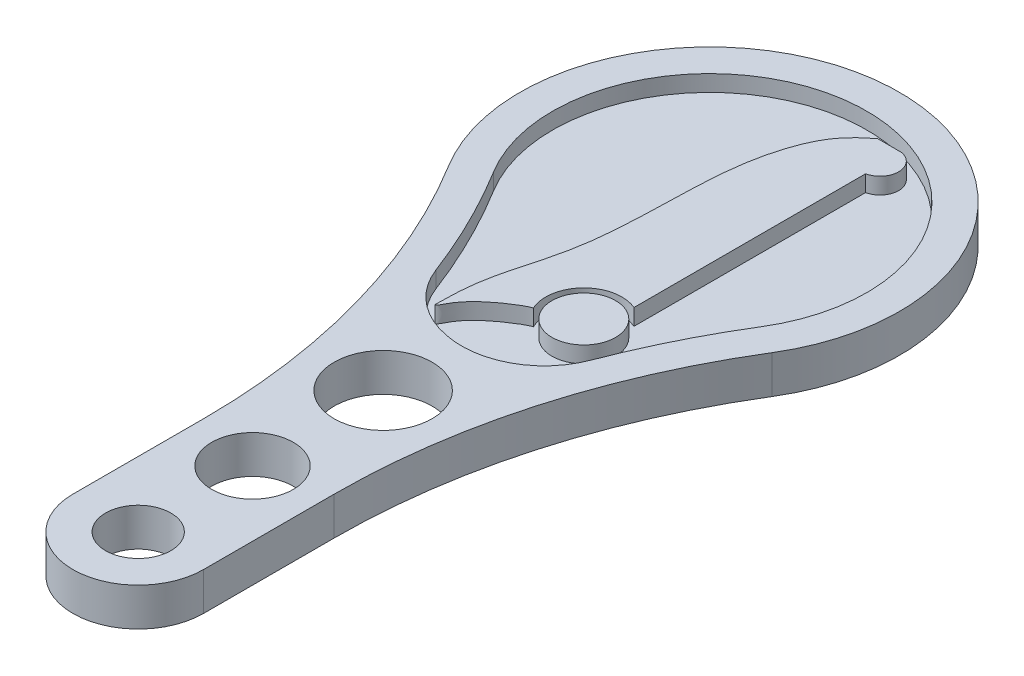
from build123d import *

# Parameters (mm, degrees)
SKETCH1_R               = 2
BOSS_EXTRUDE1_DEPTH     = 2.33
FILLET1_R               = 40
SKETCH3_R               = 2.5
SKETCH3_R_2             = 3
CUT_EXTRUDE1_DEPTH      = 41.762354262
CUT_EXTRUDE3_DEPTH      = 1
BOSS_EXTRUDE3_START     = -1
BOSS_EXTRUDE3_OUTLINE_R = 1.949204175
BOSS_EXTRUDE3_DEPTH     = 1
FILLET2_R               = 5


# Read off the part's stored shape, not the designer's step: Boss-Extrude3
with BuildPart() as part:
    # Sketch1 → Boss-Extrude1 (new body)
    with BuildSketch(Plane(origin=(0, 0, 0), x_dir=(1, 0, 0), z_dir=(0, 1, 0))):
        with BuildLine():
            Line((-3.993715603, -10.917456695), (-4, -35))
            ThreePointArc((-4, -35), (0, -39), (4, -35))
            Line((4, -35), (3.999256749, -10.915428093))
            ThreePointArc((3.999256749, -10.915428093), (-0.002950403, 11.624999626), (-3.993715603, -10.917456695))
        make_face()
        with Locations(Location((0, -35, 0), (0, 0, 270))):
            Circle(SKETCH1_R, mode=Mode.SUBTRACT)
    extrude(amount=BOSS_EXTRUDE1_DEPTH)

    # Fillet1
    fillet1_edges = [part.edges().sort_by_distance(p)[0] for p in [
        (3.999256749, 1.165, 10.915428093),
        (-3.993715603, 1.165, 10.917456695),
    ]]
    fillet(fillet1_edges, radius=FILLET1_R)

    # Sketch3 → Cut-Extrude1 (cut, through all)
    with BuildSketch(Plane(origin=(0, 2.33, 0), x_dir=(1, 0, 0), z_dir=(0, 1, 0))):
        with Locations(Location((0, -28, 0), (0, 0, 270))):
            Circle(SKETCH3_R)
        with Locations(Location((0, -20, 0), (0, 0, 270))):
            Circle(SKETCH3_R_2)
    extrude(amount=-CUT_EXTRUDE1_DEPTH, mode=Mode.SUBTRACT)

    # Sketch12 → Cut-Extrude3 (cut)
    with BuildSketch(Plane(origin=(0, 2.33, 0), x_dir=(1, 0, 0), z_dir=(0, 1, 0))):
        with BuildLine():
            ThreePointArc((8.203343823, -5.034458772), (5.941708971, -9.23828641), (4.171703771, -13.671596755))
            add(Edge.make_bspline(
                [(-4.187068138, -13.623308604), (-1.141891972, -15.774669541), (1.16463665, -15.774669541), (4.171703771, -13.671596755)],
                knots=[0, 0, 0, 0, 1, 1, 1, 1], degree=3))
            ThreePointArc((-4.187068138, -13.623308604), (-5.951923746, -9.215482827), (-8.203001159, -5.035017078))
            ThreePointArc((-8.203001159, -5.035017078), (-0.000327538, 9.624999994), (8.203343823, -5.034458772))
        make_face()
    extrude(amount=-CUT_EXTRUDE3_DEPTH, mode=Mode.SUBTRACT)

    # Fillet2
    fillet2_edges = [part.edges().sort_by_distance(p)[0] for p in [
        (4.171703771, 1.83, 13.671596755),
        (-4.187068138, 1.83, 13.623308604),
    ]]
    fillet(fillet2_edges, radius=FILLET2_R)


with BuildPart() as body_2:
    # Boss-Extrude3 outline → Boss-Extrude3 (new body)
    with BuildSketch(Plane(origin=(0, 2.33, 0), x_dir=(1, 0, 0), z_dir=(0, 1, 0)).offset(BOSS_EXTRUDE3_START)):
        with BuildLine():
            Line((3.281117116, 8.494925514), (1.781117116, 8.494925514))
            add(Edge.make_bspline(
                [(1.781117116, 8.494925514), (1.183180059, 8.004689197), (0.982734781, 7.851579078), (0.615420043, 7.446266263), (0.33043447, 7.110616589), (0.1467771, 6.857296079), (-0.083510311, 6.454804461), (-0.339895148, 5.961263649), (-0.668740254, 5.130149544), (-0.942295018, 4.231326747), (-1.147855824, 3.080080282), (-1.28640882, 2.292482291), (-1.28640882, 1.551154161), (-1.373920485, 0.287096774), (-1.453784327, -1.929298886), (-0.777696731, -4.107146497), (-1.586776077, -5.484260387), (-1.314293328, -6.862486953), (-1.564788612, -7.973016044), (-3.159608585, -9.676383972), (-2.893209822, -11.679284919), (-2.964841412, -13.861545101)],
                knots=[0, 0, 0, 0, 0, 0, 0, 0, 0, 0, 0, 0, 0, 0, 0, 0, 0, 0, 0, 0, 0, 0, 1, 1, 1, 1, 1, 1, 1, 1, 1, 1, 1, 1, 1, 1, 1, 1, 1, 1, 1, 1, 1, 1], degree=21))
            add(Edge.make_bspline(
                [(-2.964841412, -13.861545101), (-2.68941343, -13.857740882), (-2.764683546, -13.138994944), (-2.086029899, -12.417028626), (-1.115412929, -11.751425652), (-0.16044275, -11.127005362), (0.226117199, -11.029671441)],
                knots=[0, 0, 0, 0, 0, 0, 0, 1, 1, 1, 1, 1, 1, 1], degree=6))
            ThreePointArc((0.226117199, -11.029671441), (0.689271081, -8.429488184), (3.281117116, -7.921749452))
            Line((3.281117116, -7.921749452), (3.281117116, 6.265660141))
            ThreePointArc((3.281117116, 6.265660141), (4.190467303, 7.378260653), (3.281117116, 8.490861165))
            Line((3.281117116, 8.490861165), (3.281117116, 8.494925514))
        make_face()
        with Locations((2.355847123, -10.067685567)):
            Circle(BOSS_EXTRUDE3_OUTLINE_R)
    extrude(amount=BOSS_EXTRUDE3_DEPTH)


solid = Compound([part.part, body_2.part])
